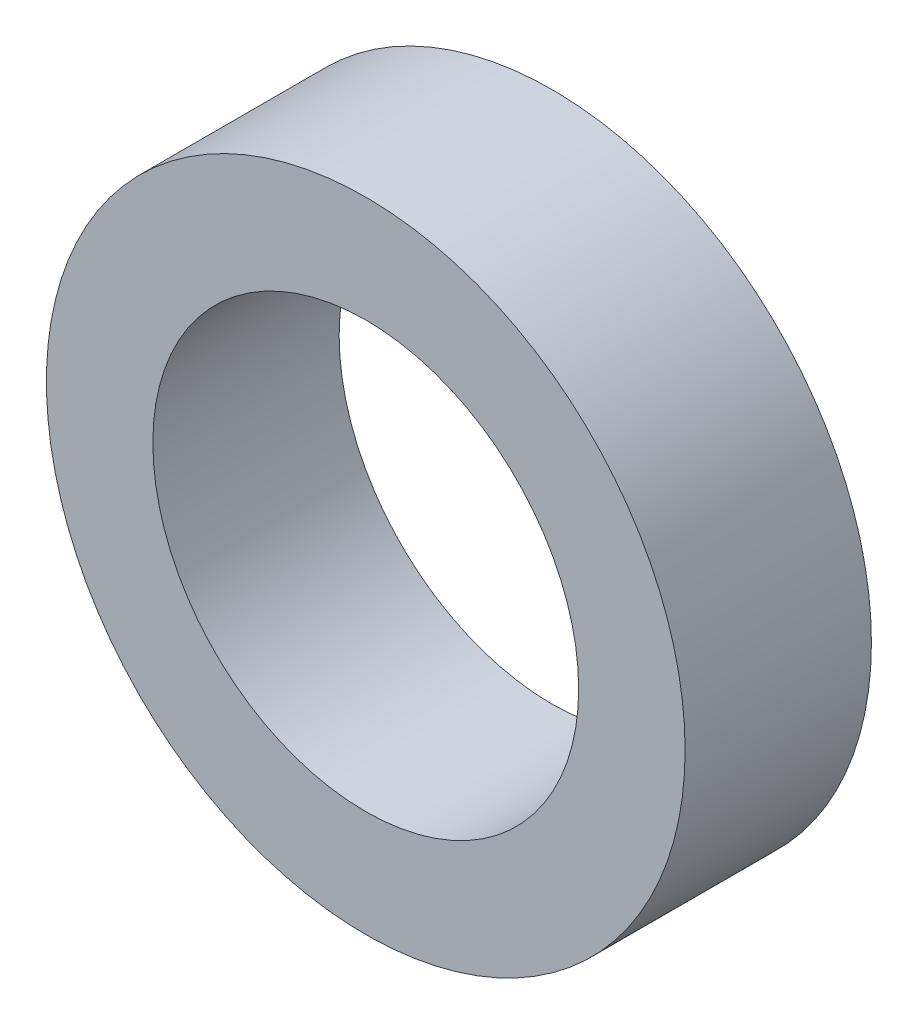
from build123d import *

# Parameters (mm, degrees)
SKETCH_1_R          = 6
EXTRUDE_1_DEPTH     = 3.5
SKETCH_1_8_R        = 4
CUT_EXTRUDE_2_DEPTH = 3.5


with BuildPart() as part:
    # 草图1 → 凸台-拉伸1 (new body)
    with BuildSketch(Plane.XY):
        Circle(SKETCH_1_R)
    extrude(amount=EXTRUDE_1_DEPTH)

    # 草图1<8> → 切除-拉伸2 (cut)
    with BuildSketch(Plane.XY):
        Circle(SKETCH_1_8_R)
    extrude(amount=CUT_EXTRUDE_2_DEPTH, mode=Mode.SUBTRACT)


solid = part.part
